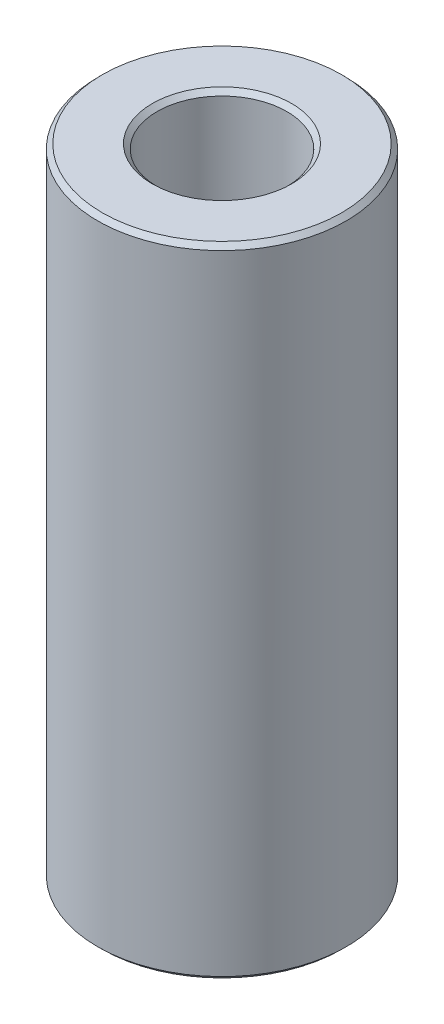
from build123d import *
from OCP.BRepFilletAPI import BRepFilletAPI_MakeChamfer

# Parameters (mm, degrees)
SKETCH1_R           = 50
BOSS_EXTRUDE1_DEPTH = 256.725797624
SKETCH2_R           = 26.128344834
CUT_EXTRUDE1_DEPTH  = 267.285814804
CHAMFER1_SIZE       = 1.912990413
CHAMFER1_SIZE2      = 1.848801862


with BuildPart() as part:
    # Sketch1 → Boss-Extrude1 (new body)
    with BuildSketch(Plane(origin=(0, 0, 0), x_dir=(1, 0, 0), z_dir=(0, 1, 0))):
        Circle(SKETCH1_R)
    extrude(amount=BOSS_EXTRUDE1_DEPTH)

    # Sketch2 → Cut-Extrude1 (cut, through all)
    with BuildSketch(Plane(origin=(0, 0, 0), x_dir=(1, 0, 0), z_dir=(0, 1, 0))):
        Circle(SKETCH2_R)
    extrude(amount=CUT_EXTRUDE1_DEPTH, mode=Mode.SUBTRACT)

    # Chamfer1: one chamfer whose edges measure the first distance from different faces: ONE call of the kernel's chamfer builder (chamfer() names one face for all edges)
    chamfer1_edges_1 = [part.edges().sort_by_distance(p)[0] for p in [
        (-26.128344834, 256.725797624, 0),
    ]]
    chamfer1_side_1 = [part.faces().sort_by_distance(p)[0] for p in [
        (-48.585786438, 256.725797624, 0),
    ]]
    chamfer1_edges_2 = [part.edges().sort_by_distance(p)[0] for p in [
        (-26.128344834, 0, 0),
    ]]
    chamfer1_side_2 = [part.faces().sort_by_distance(p)[0] for p in [
        (-26.128344834, 128.362898812, 0),
    ]]
    chamfer1_edges_3 = [part.edges().sort_by_distance(p)[0] for p in [
        (-50, 0, 0),
    ]]
    chamfer1_side_3 = [part.faces().sort_by_distance(p)[0] for p in [
        (-48.585786438, 0, 0),
    ]]
    chamfer1_edges_4 = [part.edges().sort_by_distance(p)[0] for p in [
        (-50, 256.725797624, 0),
    ]]
    chamfer1_side_4 = [part.faces().sort_by_distance(p)[0] for p in [
        (-50, 128.362898812, 0),
    ]]
    chamfer1 = BRepFilletAPI_MakeChamfer(part.part.solid().wrapped)
    for e in chamfer1_edges_1:
        chamfer1.Add(CHAMFER1_SIZE, CHAMFER1_SIZE2, e.wrapped, chamfer1_side_1[0].wrapped)  # the first distance lies on this face
    for e in chamfer1_edges_2:
        chamfer1.Add(CHAMFER1_SIZE, CHAMFER1_SIZE2, e.wrapped, chamfer1_side_2[0].wrapped)  # the first distance lies on this face
    for e in chamfer1_edges_3:
        chamfer1.Add(CHAMFER1_SIZE, CHAMFER1_SIZE2, e.wrapped, chamfer1_side_3[0].wrapped)  # the first distance lies on this face
    for e in chamfer1_edges_4:
        chamfer1.Add(CHAMFER1_SIZE, CHAMFER1_SIZE2, e.wrapped, chamfer1_side_4[0].wrapped)  # the first distance lies on this face
    add(Compound.cast(chamfer1.Shape()), mode=Mode.REPLACE)


solid = part.part
